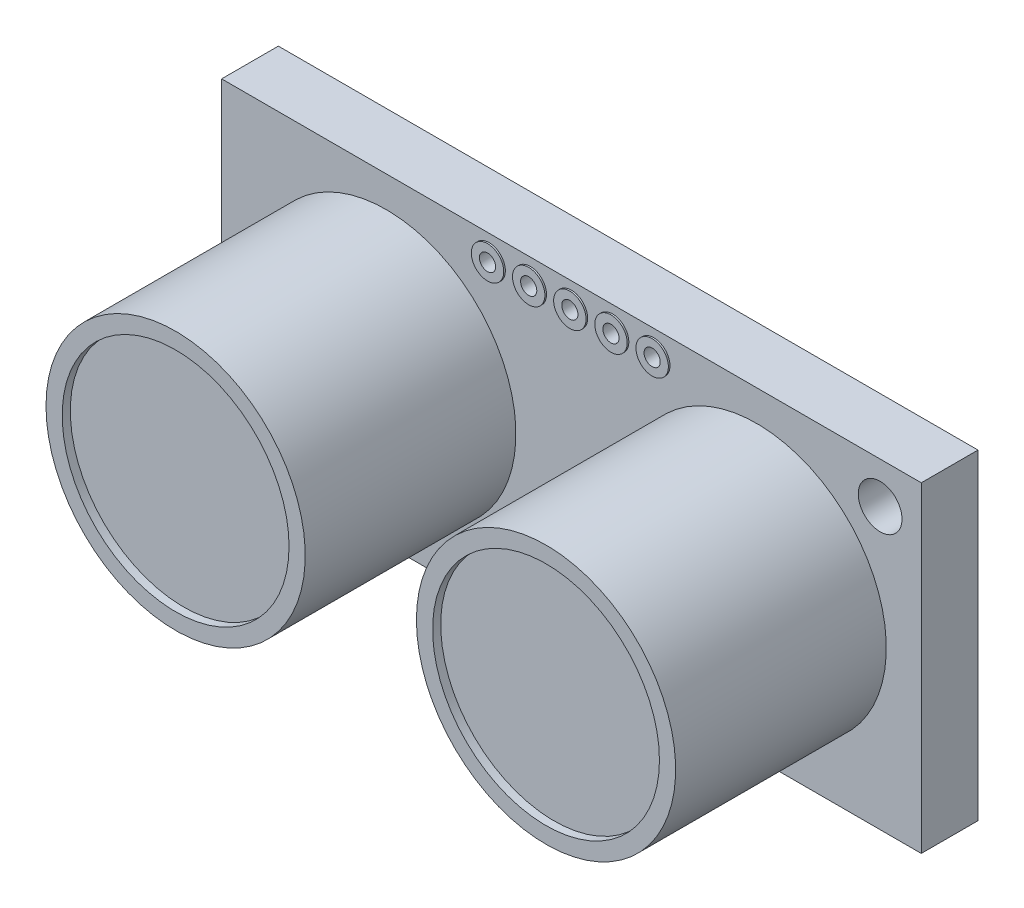
from build123d import *

# Parameters (mm, degrees)
SKETCH1_W                = 43.18
SKETCH1_H                = 19.812
SKETCH1_R                = 1.35
BOSS_EXTRUDE1_DEPTH      = 3.5
SKETCH2_R                = 8
BOSS_EXTRUDE2_DEPTH      = 13
SKETCH3_R                = 7
CUT_EXTRUDE1_DEPTH       = 0.5
EXTRUDE_THIN4_DEPTH      = 0.1
EXTRUDE_THIN4_DEPTH_BACK = 3.6
SKETCH4_R                = 1
SKETCH4_R_2              = 0.5
SKETCH11_R               = 0.5
CUT_EXTRUDE2_DEPTH       = 28.078717399
BOSS_EXTRUDE3_DEPTH      = 0.001


with BuildPart() as part:
    # Sketch1 → Boss-Extrude1 (new body)
    with BuildSketch(Plane.XY):
        Rectangle(SKETCH1_W, SKETCH1_H)
        with Locations((-19.05, -7.366)):
            Circle(SKETCH1_R, mode=Mode.SUBTRACT)
        with Locations((19.05, 7.366)):
            Circle(SKETCH1_R, mode=Mode.SUBTRACT)
    extrude(amount=BOSS_EXTRUDE1_DEPTH)

    # Sketch2 → Boss-Extrude2 (add)
    with BuildSketch(Plane.XY.offset(3.5)):
        with Locations((-11.43, 0)):
            Circle(SKETCH2_R)
        with Locations((11.43, 0)):
            Circle(SKETCH2_R)
    extrude(amount=BOSS_EXTRUDE2_DEPTH)

    # Sketch3 → Cut-Extrude1 (cut)
    with BuildSketch(Plane.XY.offset(16.5)):
        with Locations((-11.43, 0)):
            Circle(SKETCH3_R)
        with Locations((11.43, 0)):
            Circle(SKETCH3_R)
    extrude(amount=-CUT_EXTRUDE1_DEPTH, mode=Mode.SUBTRACT)

    # Sketch4 → Extrude-Thin4 (add, two sides: drawn at the far end of the back side and taken through both)
    # profile 1 of 10: a face of its own
    with BuildSketch(Plane.XY.offset(3.5).offset(-EXTRUDE_THIN4_DEPTH_BACK)):
        with Locations((0, 8.406)):
            Circle(SKETCH4_R)
        with Locations((0, 8.406)):
            Circle(SKETCH4_R_2, mode=Mode.SUBTRACT)
    # profile 2 of 10: a face of its own
    with BuildSketch(Plane.XY.offset(3.5).offset(-EXTRUDE_THIN4_DEPTH_BACK)):
        with Locations((2.54, 8.406)):
            Circle(SKETCH4_R)
        with Locations((2.54, 8.406)):
            Circle(SKETCH4_R_2, mode=Mode.SUBTRACT)
    # profile 3 of 10: a face of its own
    with BuildSketch(Plane.XY.offset(3.5).offset(-EXTRUDE_THIN4_DEPTH_BACK)):
        with Locations((5.08, 8.406)):
            Circle(SKETCH4_R)
        with Locations((5.08, 8.406)):
            Circle(SKETCH4_R_2, mode=Mode.SUBTRACT)
    # profile 4 of 10: a face of its own
    with BuildSketch(Plane.XY.offset(3.5).offset(-EXTRUDE_THIN4_DEPTH_BACK)):
        with Locations((-5.08, 8.406)):
            Circle(SKETCH4_R)
        with Locations((-5.08, 8.406)):
            Circle(SKETCH4_R_2, mode=Mode.SUBTRACT)
    # profile 5 of 10: a face of its own
    with BuildSketch(Plane.XY.offset(3.5).offset(-EXTRUDE_THIN4_DEPTH_BACK)):
        with Locations((-2.54, 8.406)):
            Circle(SKETCH4_R)
        with Locations((-2.54, 8.406)):
            Circle(SKETCH4_R_2, mode=Mode.SUBTRACT)
    # profile 6 of 10: a face of its own
    with BuildSketch(Plane.XY.offset(3.5).offset(-EXTRUDE_THIN4_DEPTH_BACK)):
        with Locations((-5.08, -8.406)):
            Circle(SKETCH4_R)
        with Locations((-5.08, -8.406)):
            Circle(SKETCH4_R_2, mode=Mode.SUBTRACT)
    # profile 7 of 10: a face of its own
    with BuildSketch(Plane.XY.offset(3.5).offset(-EXTRUDE_THIN4_DEPTH_BACK)):
        with Locations((-2.54, -8.406)):
            Circle(SKETCH4_R)
        with Locations((-2.54, -8.406)):
            Circle(SKETCH4_R_2, mode=Mode.SUBTRACT)
    # profile 8 of 10: a face of its own
    with BuildSketch(Plane.XY.offset(3.5).offset(-EXTRUDE_THIN4_DEPTH_BACK)):
        with Locations((0, -8.406)):
            Circle(SKETCH4_R)
        with Locations((0, -8.406)):
            Circle(SKETCH4_R_2, mode=Mode.SUBTRACT)
    # profile 9 of 10: a face of its own
    with BuildSketch(Plane.XY.offset(3.5).offset(-EXTRUDE_THIN4_DEPTH_BACK)):
        with Locations((2.54, -8.406)):
            Circle(SKETCH4_R)
        with Locations((2.54, -8.406)):
            Circle(SKETCH4_R_2, mode=Mode.SUBTRACT)
    # profile 10 of 10: a face of its own
    with BuildSketch(Plane.XY.offset(3.5).offset(-EXTRUDE_THIN4_DEPTH_BACK)):
        with Locations((5.08, -8.406)):
            Circle(SKETCH4_R)
        with Locations((5.08, -8.406)):
            Circle(SKETCH4_R_2, mode=Mode.SUBTRACT)
    extrude(amount=EXTRUDE_THIN4_DEPTH + EXTRUDE_THIN4_DEPTH_BACK)

    # Sketch11 → Cut-Extrude2 (cut, through all)
    with BuildSketch(Plane.XY.offset(3.5)):
        with Locations((-5.08, -8.406)):
            Circle(SKETCH11_R)
        with Locations((-2.54, -8.406)):
            Circle(SKETCH11_R)
        with Locations((0, -8.406)):
            Circle(SKETCH11_R)
        with Locations((2.54, -8.406)):
            Circle(SKETCH11_R)
        with Locations((5.08, -8.406)):
            Circle(SKETCH11_R)
        with Locations((-5.08, 8.406)):
            Circle(SKETCH11_R)
        with Locations((-2.54, 8.406)):
            Circle(SKETCH11_R)
        with Locations((0, 8.406)):
            Circle(SKETCH11_R)
        with Locations((2.54, 8.406)):
            Circle(SKETCH11_R)
        with Locations((5.08, 8.406)):
            Circle(SKETCH11_R)
    extrude(amount=-CUT_EXTRUDE2_DEPTH, mode=Mode.SUBTRACT)

    # Sketch12 → Boss-Extrude3 (add)
    # profile 1 of 5: a face of its own
    with BuildSketch(Plane(origin=(0, 0, 0), x_dir=(-1, 0, 0), z_dir=(0, 0, -1))):
        with BuildLine():
            add(Edge.make_bspline(
                [(19.46929145, -2.683893026), (19.484417806, -2.684223579), (19.51433311, -2.684877312), (19.55857677, -2.689412347), (19.601609877, -2.696623598), (19.643529262, -2.706555749), (19.684115837, -2.719918963), (19.723610749, -2.736127809), (19.762201128, -2.75474264), (19.799136653, -2.77713075), (19.834715807, -2.80169308), (19.86828259, -2.829333068), (19.900019773, -2.859416979), (19.929842776, -2.892296508), (19.95696226, -2.928352739), (19.982882923, -2.966466663), (20.006501357, -3.007561369), (20.028166536, -3.051214815), (20.047339104, -3.097375117), (20.064173328, -3.145621658), (20.078768602, -3.195935133), (20.090261272, -3.24837133), (20.099075501, -3.302915202), (20.10540034, -3.359565322), (20.109601073, -3.418341945), (20.109976956, -3.458260498), (20.110167222, -3.478466619)],
                knots=[0, 0, 0, 0, 0.949010564, 1.876852617, 2.787529374, 3.685273709, 4.577074086, 5.465471387, 6.362587764, 7.262213343, 8.172580635, 9.073145362, 9.987411958, 10.914456489, 11.85451744, 12.815917507, 13.804911429, 14.825868585, 15.871774033, 16.938849417, 18.030625794, 19.156736427, 20.304747212, 21.4957645, 22.732396811, 24, 24, 24, 24], degree=3))
            add(Edge.make_bspline(
                [(20.110167222, -3.478466619), (20.109713592, -3.502551257), (20.108822914, -3.54984022), (20.103860332, -3.619166231), (20.094377913, -3.685161229), (20.082197449, -3.748129578), (20.065811319, -3.807833441), (20.045507132, -3.864154145), (20.022642346, -3.91766615), (20.003613894, -3.950828686), (19.994191581, -3.967249769)],
                knots=[0, 0, 0, 0, 1.136969792, 2.232382444, 3.278022597, 4.282276305, 5.258039159, 6.196692155, 7.1070566, 8, 8, 8, 8], degree=3))
            add(Edge.make_bspline(
                [(19.994191581, -3.967249769), (19.980125855, -3.988503916), (19.952188373, -4.030719109), (19.900998849, -4.087338382), (19.843562074, -4.138033515), (19.780391, -4.18158225), (19.714579966, -4.217072851), (19.648412339, -4.243220973), (19.582822371, -4.259318087), (19.539200268, -4.261525811), (19.517848725, -4.262606417)],
                knots=[0, 0, 0, 0, 1.048346287, 2.082235551, 3.132143771, 4.197203545, 5.234784445, 6.204564675, 7.121195205, 8, 8, 8, 8], degree=3))
            add(Edge.make_bspline(
                [(19.517848725, -4.262606417), (19.505880841, -4.261996217), (19.482506815, -4.260804457), (19.448934686, -4.251239838), (19.418256579, -4.235582628), (19.390595856, -4.214519543), (19.367774744, -4.188124339), (19.351003002, -4.157808329), (19.340409896, -4.124045436), (19.339393406, -4.100293963), (19.338869017, -4.088041007)],
                knots=[0, 0, 0, 0, 1.029346977, 2.010378973, 2.978887221, 3.98112847, 4.985683985, 5.960201932, 6.947705008, 8, 8, 8, 8], degree=3))
            add(Edge.make_bspline(
                [(19.338869017, -4.088041007), (19.339245694, -4.078080516), (19.339975706, -4.058776797), (19.348168728, -4.031204492), (19.36058334, -4.005800586), (19.37898544, -3.982970809), (19.401999508, -3.962194269), (19.429956992, -3.943235584), (19.462379414, -3.925486113), (19.486424996, -3.91601565), (19.498987635, -3.911067797)],
                knots=[0, 0, 0, 0, 0.932019786, 1.806281372, 2.676477655, 3.570524242, 4.53911087, 5.576821434, 6.734007876, 8, 8, 8, 8], degree=3))
            add(Edge.make_bspline(
                [(19.498987635, -3.911067797), (19.514154901, -3.904497014), (19.543429775, -3.891814514), (19.585067298, -3.871507385), (19.622251922, -3.849696316), (19.656489949, -3.82744116), (19.687800087, -3.802502501), (19.714997365, -3.772135305), (19.740183391, -3.737971347), (19.761936387, -3.698509866), (19.780332925, -3.653726361), (19.792758911, -3.602341133), (19.800986198, -3.544947653), (19.801631627, -3.504449709), (19.80196898, -3.483282216)],
                knots=[0, 0, 0, 0, 1.049630502, 2.025928848, 2.939419198, 3.785195675, 4.618337008, 5.47201057, 6.365697361, 7.308725407, 8.32613671, 9.430404736, 10.656922266, 12, 12, 12, 12], degree=3))
            add(Edge.make_bspline(
                [(19.80196898, -3.483282216), (19.801786665, -3.468289639), (19.801429478, -3.438916536), (19.797209523, -3.39604058), (19.790984576, -3.355224522), (19.781715623, -3.316744761), (19.770034495, -3.280393465), (19.756022784, -3.246070232), (19.739234454, -3.213860117), (19.719531242, -3.184397308), (19.698330902, -3.157558433), (19.676051651, -3.13356403), (19.651734729, -3.113808265), (19.626201925, -3.097691901), (19.599724219, -3.084476637), (19.571616619, -3.075919648), (19.542461561, -3.069773451), (19.522430697, -3.06935428), (19.512230528, -3.069140828)],
                knots=[0, 0, 0, 0, 1.280312405, 2.508357684, 3.676903495, 4.804965861, 5.885491899, 6.935930188, 7.96843881, 8.982636488, 9.958848435, 10.888398438, 11.773624114, 12.626391924, 13.464564268, 14.292153698, 15.130326042, 16, 16, 16, 16], degree=3))
            add(Edge.make_bspline(
                [(19.512230528, -3.069140828), (19.496494601, -3.069862799), (19.466161185, -3.071254509), (19.423077099, -3.083358943), (19.384333744, -3.102661617), (19.351407073, -3.130916015), (19.322475421, -3.164394049), (19.297717898, -3.203046341), (19.27585837, -3.245712555), (19.257854232, -3.293840184), (19.241563213, -3.348197534), (19.224705921, -3.410023046), (19.207664422, -3.480218562), (19.196344494, -3.529818585), (19.190388093, -3.555917479)],
                knots=[0, 0, 0, 0, 0.888922646, 1.713534847, 2.512522705, 3.3189352, 4.1507089, 5.009465297, 5.910012526, 6.858957344, 7.912524916, 9.120887575, 10.485048098, 12, 12, 12, 12], degree=3))
            add(Edge.make_bspline(
                [(19.190388093, -3.555917479), (19.181929691, -3.590087259), (19.165660619, -3.655810153), (19.138396278, -3.749704133), (19.107487465, -3.834351038), (19.075996763, -3.911613713), (19.039365433, -3.980627007), (18.996986053, -4.042080143), (18.948115752, -4.095761163), (18.902393794, -4.13442943), (18.86273622, -4.160699668), (18.831410889, -4.178047101), (18.798259358, -4.192636269), (18.763245036, -4.204110897), (18.726634467, -4.213350814), (18.688309172, -4.220246185), (18.648186982, -4.224299229), (18.620819207, -4.224686994), (18.606898192, -4.224884237)],
                knots=[0, 0, 0, 0, 1.736572963, 3.340162069, 4.820136415, 6.180570834, 7.453029487, 8.666721429, 9.853271306, 11.024342417, 11.610026699, 12.197789198, 12.78876586, 13.39394109, 14.013340947, 14.650211638, 15.313410593, 16, 16, 16, 16], degree=3))
            add(Edge.make_bspline(
                [(18.606898192, -4.224884237), (18.593504819, -4.224740931), (18.567042485, -4.224457791), (18.527951434, -4.219539845), (18.489840843, -4.213216925), (18.453112282, -4.202724962), (18.417329584, -4.190475928), (18.382581113, -4.175232627), (18.349418394, -4.156536443), (18.317126027, -4.135826985), (18.286692517, -4.111986582), (18.25762662, -4.08581059), (18.230312173, -4.057111963), (18.205669793, -4.025320842), (18.181514952, -3.992245277), (18.160416695, -3.955702998), (18.14091815, -3.91689848), (18.11625726, -3.861474515), (18.091695675, -3.786346212), (18.070365196, -3.689863343), (18.058072069, -3.585795903), (18.056383732, -3.513947159), (18.055512274, -3.47686142)],
                knots=[0, 0, 0, 0, 0.769461614, 1.520285473, 2.262551752, 2.988378485, 3.713226575, 4.436358852, 5.166208618, 5.900059362, 6.640050888, 7.38609301, 8.147789305, 8.914131076, 9.697346069, 10.500657756, 11.336485078, 12.193936862, 13.986438256, 15.869279717, 17.867870641, 20, 20, 20, 20], degree=3))
            add(Edge.make_bspline(
                [(18.055512274, -3.47686142), (18.05600825, -3.447276945), (18.056966469, -3.390120075), (18.065519679, -3.307472284), (18.079250927, -3.231021329), (18.098946205, -3.160799164), (18.123752788, -3.096740742), (18.151543955, -3.038011171), (18.183353447, -2.98499297), (18.218799743, -2.938098441), (18.256208591, -2.896738524), (18.29544728, -2.86187447), (18.334774717, -2.831879), (18.375544801, -2.808851006), (18.416194468, -2.790441669), (18.45663055, -2.777736893), (18.496605537, -2.769471846), (18.523121397, -2.768598858), (18.536269428, -2.768165983)],
                knots=[0, 0, 0, 0, 1.50180492, 2.901470176, 4.213680385, 5.441471803, 6.598163128, 7.697894763, 8.73692932, 9.731292389, 10.678417777, 11.563424905, 12.393422888, 13.184490135, 13.9355001, 14.655109254, 15.333128709, 16, 16, 16, 16], degree=3))
            add(Edge.make_bspline(
                [(18.536269428, -2.768165983), (18.547968876, -2.768793298), (18.571072832, -2.770032115), (18.604767094, -2.779696382), (18.636323295, -2.79565456), (18.665371842, -2.817096846), (18.690072435, -2.843185233), (18.708902898, -2.872979724), (18.719626181, -2.906578955), (18.72097737, -2.929949853), (18.721669933, -2.941928794)],
                knots=[0, 0, 0, 0, 0.996524447, 1.967926831, 2.962621832, 3.998325838, 5.031199617, 6.009342139, 6.979672482, 8, 8, 8, 8], degree=3))
            add(Edge.make_bspline(
                [(18.721669933, -2.941928794), (18.721237923, -2.952509599), (18.720422718, -2.97247568), (18.71565128, -3.000753797), (18.705808035, -3.024736317), (18.692326163, -3.045597334), (18.674096087, -3.06379414), (18.652013526, -3.082466258), (18.625325748, -3.101924205), (18.605379739, -3.114352949), (18.594859198, -3.120908502)],
                knots=[0, 0, 0, 0, 1.091037725, 2.058798536, 2.936702634, 3.743333543, 4.601209271, 5.578930148, 6.723004324, 8, 8, 8, 8], degree=3))
            add(Edge.make_bspline(
                [(18.594859198, -3.120908502), (18.575539247, -3.130312653), (18.538259559, -3.14845886), (18.487226134, -3.180663145), (18.443363111, -3.216252044), (18.411121732, -3.248091479), (18.388932809, -3.276172478), (18.375392396, -3.300675856), (18.36395225, -3.327916675), (18.354092471, -3.357915788), (18.347112663, -3.391039717), (18.341977684, -3.42710389), (18.338748427, -3.466102827), (18.338272979, -3.493040834), (18.338027329, -3.506958904)],
                knots=[0, 0, 0, 0, 1.547925219, 2.986869477, 4.337480217, 5.612327564, 6.244828973, 6.909713596, 7.622436063, 8.372459485, 9.181850378, 10.058552105, 10.996911345, 12, 12, 12, 12], degree=3))
            add(Edge.make_bspline(
                [(18.338027329, -3.506958904), (18.338865045, -3.532558407), (18.340463722, -3.581411873), (18.352743768, -3.651016511), (18.374037305, -3.712842943), (18.398984211, -3.758442548), (18.422788372, -3.789499691), (18.44081972, -3.810017039), (18.460169787, -3.826920103), (18.480431517, -3.840723538), (18.501450251, -3.851609225), (18.523287707, -3.860004514), (18.546272099, -3.86424575), (18.561805072, -3.864961487), (18.569577311, -3.865319621)],
                knots=[0, 0, 0, 0, 1.953936482, 3.728844638, 5.372901677, 6.927342473, 7.670868145, 8.357884895, 9.009286022, 9.626820382, 10.225224998, 10.813344112, 11.406232554, 12, 12, 12, 12], degree=3))
            add(Edge.make_bspline(
                [(18.569577311, -3.865319621), (18.579113211, -3.864980933), (18.597877953, -3.864314463), (18.624868169, -3.857681525), (18.649829947, -3.847135242), (18.67264924, -3.832338988), (18.693462973, -3.81368373), (18.712613766, -3.79174254), (18.73098022, -3.767342768), (18.751816257, -3.730051612), (18.774805884, -3.681539116), (18.791979424, -3.629173216), (18.805454941, -3.582429304), (18.816688397, -3.537433055), (18.831039039, -3.483002716), (18.840542262, -3.443308216), (18.845671569, -3.421883348)],
                knots=[0, 0, 0, 0, 0.710597064, 1.398312741, 2.060329599, 2.724976052, 3.418105476, 4.139422309, 4.896209246, 5.692466705, 7.322744487, 8.895039973, 9.798770174, 10.953818098, 12.355841563, 14, 14, 14, 14], degree=3))
            add(Edge.make_bspline(
                [(18.845671569, -3.421883348), (18.852243438, -3.39456596), (18.865099634, -3.341126413), (18.885959774, -3.263074468), (18.907992459, -3.189099277), (18.93074843, -3.118931762), (18.955043623, -3.053188778), (18.983131163, -2.992870483), (19.012545732, -2.937168657), (19.045060109, -2.886506913), (19.081514481, -2.841201333), (19.121641686, -2.800461623), (19.167070347, -2.766064391), (19.216582316, -2.736142614), (19.271527657, -2.71228591), (19.332434707, -2.695591819), (19.3989918, -2.685475813), (19.445309679, -2.684432972), (19.46929145, -2.683893026)],
                knots=[0, 0, 0, 0, 1.267425996, 2.479397737, 3.644026965, 4.748891262, 5.806868875, 6.803181051, 7.748078724, 8.646880768, 9.513885508, 10.367259778, 11.219353025, 12.077259478, 12.971817986, 13.911770136, 14.918787934, 16, 16, 16, 16], degree=3))
        make_face()
    # profile 2 of 5: a face of its own
    with BuildSketch(Plane(origin=(0, 0, 0), x_dir=(-1, 0, 0), z_dir=(0, 0, -1))):
        with BuildLine():
            Line((19.236938869, -1.800230878), (19.236938869, -1.939080607))
            Line((19.236938869, -1.939080607), (19.867782146, -1.939080607))
            add(Edge.make_bspline(
                [(19.867782146, -1.939080607), (19.887227731, -1.939569463), (19.923611489, -1.940484139), (19.974280577, -1.950401281), (20.017014821, -1.967090735), (20.051586482, -1.990674356), (20.077777649, -2.01990028), (20.096740238, -2.053243428), (20.108349006, -2.090822708), (20.10955054, -2.117308302), (20.110167222, -2.130901909)],
                knots=[0, 0, 0, 0, 1.331902197, 2.492062242, 3.520752585, 4.456973203, 5.333663409, 6.188000262, 7.069999586, 8, 8, 8, 8], degree=3))
            add(Edge.make_bspline(
                [(20.110167222, -2.130901909), (20.109373291, -2.145409776), (20.107847372, -2.173293636), (20.09683532, -2.212967924), (20.076205729, -2.24664497), (20.048918398, -2.275511003), (20.013410064, -2.297766017), (19.970726045, -2.313122177), (19.921183627, -2.322818647), (19.88575683, -2.3238054), (19.866979546, -2.32432841)],
                knots=[0, 0, 0, 0, 0.98758274, 1.898116353, 2.767902367, 3.650180778, 4.579683533, 5.591031871, 6.723173417, 8, 8, 8, 8], degree=3))
            Line((19.866979546, -2.32432841), (18.351270222, -2.32432841))
            add(Edge.make_bspline(
                [(18.351270222, -2.32432841), (18.331280944, -2.323740288), (18.293773724, -2.322636755), (18.24188352, -2.311937018), (18.198309786, -2.294538775), (18.163257167, -2.268807182), (18.137095477, -2.234173002), (18.11923, -2.191152639), (18.108558909, -2.139709432), (18.107464294, -2.102600256), (18.106878648, -2.082745934)],
                knots=[0, 0, 0, 0, 1.204539147, 2.260157444, 3.178834964, 4.014831347, 4.849268471, 5.763683293, 6.803515522, 8, 8, 8, 8], degree=3))
            Line((18.106878648, -2.082745934), (18.106878648, -1.442271461))
            add(Edge.make_bspline(
                [(18.106878648, -1.442271461), (18.107059476, -1.42100132), (18.107407569, -1.380056515), (18.109303723, -1.320900151), (18.112849589, -1.266553391), (18.117921188, -1.216426566), (18.125407338, -1.169982505), (18.136034656, -1.126315058), (18.148886368, -1.084761869), (18.160527911, -1.058662721), (18.166271017, -1.045787265)],
                knots=[0, 0, 0, 0, 1.263018195, 2.431297115, 3.513891869, 4.496307935, 5.422122339, 6.30446181, 7.163542459, 8, 8, 8, 8], degree=3))
            add(Edge.make_bspline(
                [(18.166271017, -1.045787265), (18.173186513, -1.030381203), (18.186937288, -0.999747782), (18.213068639, -0.956540312), (18.243033035, -0.915964655), (18.27740064, -0.878682035), (18.314738259, -0.844403579), (18.35614933, -0.815189152), (18.399953527, -0.789676869), (18.44667819, -0.768825651), (18.495523638, -0.752581195), (18.54592107, -0.740211327), (18.597885926, -0.73347835), (18.632965113, -0.732475909), (18.650639869, -0.731970825)],
                knots=[0, 0, 0, 0, 0.991101386, 1.970706541, 2.959125982, 3.949043219, 4.94477413, 5.930285116, 6.919453739, 7.918248778, 8.929482208, 9.939493973, 10.961807665, 12, 12, 12, 12], degree=3))
            add(Edge.make_bspline(
                [(18.650639869, -0.731970825), (18.668583461, -0.73232809), (18.703639593, -0.733026073), (18.754754471, -0.73928432), (18.803248931, -0.748815301), (18.849139587, -0.762180424), (18.891914834, -0.780678697), (18.932132977, -0.802137642), (18.96957958, -0.827786237), (19.004173954, -0.857528021), (19.035791681, -0.89170093), (19.065916222, -0.928992469), (19.092585043, -0.97108369), (19.11714069, -1.016954235), (19.139142453, -1.067082964), (19.159163306, -1.121022773), (19.176521958, -1.179220962), (19.185676642, -1.219624181), (19.190388093, -1.240417665)],
                knots=[0, 0, 0, 0, 1.05507517, 2.061284822, 3.02416977, 3.960190338, 4.866266322, 5.760478336, 6.637811303, 7.530498893, 8.437803919, 9.372931164, 10.346335214, 11.363650695, 12.430976955, 13.56370004, 14.746160234, 16, 16, 16, 16], degree=3))
            add(Edge.make_bspline(
                [(19.190388093, -1.240417665), (19.200427827, -1.222376106), (19.220899361, -1.185588436), (19.259959389, -1.133796289), (19.304747277, -1.08278582), (19.356254388, -1.033986697), (19.411591028, -0.986799902), (19.469225772, -0.941636778), (19.528332151, -0.898760059), (19.588907267, -0.859624919), (19.648670628, -0.823618677), (19.706099342, -0.791258715), (19.760703138, -0.763640398), (19.811402894, -0.740153767), (19.856655487, -0.721449354), (19.894955835, -0.708122709), (19.925318671, -0.699169475), (19.94332506, -0.697397202), (19.950851203, -0.696656443)],
                knots=[0, 0, 0, 0, 1.035092047, 2.110606056, 3.247378518, 4.439119437, 5.667527541, 6.896357491, 8.113024158, 9.330801598, 10.514364801, 11.614385948, 12.638182879, 13.584379214, 14.418398752, 15.093545921, 15.621128711, 16, 16, 16, 16], degree=3))
            add(Edge.make_bspline(
                [(19.950851203, -0.696656443), (19.964041869, -0.697988111), (19.991453629, -0.700755473), (20.022873295, -0.717654824), (20.046183068, -0.73517527), (20.062660295, -0.75101425), (20.076500599, -0.769624107), (20.088663848, -0.79012526), (20.098335005, -0.812632242), (20.105021051, -0.837084422), (20.109741287, -0.863148392), (20.110023058, -0.881232034), (20.110167222, -0.890484244)],
                knots=[0, 0, 0, 0, 1.421053962, 2.95311776, 3.768369014, 4.575895034, 5.411397774, 6.266672613, 7.147343469, 8.048766422, 9.001682164, 10, 10, 10, 10], degree=3))
            add(Edge.make_bspline(
                [(20.110167222, -0.890484244), (20.109832205, -0.901356962), (20.109185491, -0.922345541), (20.10279153, -0.952381058), (20.093565654, -0.980199809), (20.074127778, -1.012575278), (20.044129385, -1.049196215), (20.006138096, -1.079661725), (19.970415066, -1.103157313), (19.937742869, -1.124120877), (19.899373952, -1.148105272), (19.871683967, -1.164876217), (19.856947051, -1.173801899)],
                knots=[0, 0, 0, 0, 0.812054064, 1.56758039, 2.289145878, 2.992867892, 4.379130512, 5.807652158, 6.615255223, 7.578411575, 8.711203985, 10, 10, 10, 10], degree=3))
            Line((19.856947051, -1.173801899), (19.591687887, -1.335124416))
            add(Edge.make_bspline(
                [(19.591687887, -1.335124416), (19.568712309, -1.348871396), (19.525264039, -1.374867804), (19.465196917, -1.414237897), (19.413821081, -1.45135698), (19.370496318, -1.486425891), (19.334807335, -1.520807514), (19.305094614, -1.55469524), (19.282105713, -1.589560527), (19.264098857, -1.62500043), (19.25142667, -1.663012017), (19.243523551, -1.704868082), (19.237482435, -1.750965884), (19.237125087, -1.783353374), (19.236938869, -1.800230878)],
                knots=[0, 0, 0, 0, 1.549240544, 2.929711722, 4.154429701, 5.215920692, 6.152032193, 7.019334908, 7.817977517, 8.562251951, 9.313736963, 10.127430344, 11.024181782, 12, 12, 12, 12], degree=3))
        make_face()
        with BuildLine():
            Line((18.41507689, -1.573095194), (18.41507689, -1.939080607))
            Line((18.41507689, -1.939080607), (18.954423814, -1.939080607))
            Line((18.954423814, -1.939080607), (18.954423814, -1.583930289))
            add(Edge.make_bspline(
                [(18.954423814, -1.583930289), (18.954079771, -1.561052235), (18.95341716, -1.516990022), (18.949415073, -1.453810733), (18.941134359, -1.396364754), (18.930772368, -1.34454499), (18.916521718, -1.298160403), (18.897635038, -1.257536318), (18.874321584, -1.222486007), (18.846171277, -1.193339399), (18.812927068, -1.170191533), (18.773918643, -1.154204272), (18.729500531, -1.144486988), (18.698046819, -1.143447393), (18.681539953, -1.142901815)],
                knots=[0, 0, 0, 0, 1.392674693, 2.682235545, 3.849820756, 4.922907172, 5.896284646, 6.795937237, 7.640517491, 8.44662346, 9.24840026, 10.087665541, 10.996409465, 12, 12, 12, 12], degree=3))
            add(Edge.make_bspline(
                [(18.681539953, -1.142901815), (18.668249815, -1.143268512), (18.642212955, -1.143986913), (18.604681271, -1.152433954), (18.569452481, -1.16532031), (18.537115649, -1.183502086), (18.507412206, -1.205750853), (18.482699331, -1.233431705), (18.460183411, -1.263853075), (18.44971231, -1.287133705), (18.444371775, -1.299007435)],
                knots=[0, 0, 0, 0, 1.054707271, 2.066288818, 3.042079463, 4.027441999, 5.005836686, 5.976573042, 6.967999406, 8, 8, 8, 8], degree=3))
            add(Edge.make_bspline(
                [(18.444371775, -1.299007435), (18.441988909, -1.305526806), (18.436809149, -1.319698305), (18.430881077, -1.343610178), (18.426457055, -1.371717154), (18.421820998, -1.403777985), (18.418718916, -1.440083634), (18.417027438, -1.480653587), (18.415124285, -1.525457961), (18.415093129, -1.556773176), (18.41507689, -1.573095194)],
                knots=[0, 0, 0, 0, 0.601274756, 1.307022564, 2.130372336, 3.066540635, 4.11402688, 5.286356465, 6.585603249, 8, 8, 8, 8], degree=3))
        make_face(mode=Mode.SUBTRACT)
    # profile 3 of 5: a face of its own
    with BuildSketch(Plane(origin=(0, 0, 0), x_dir=(-1, 0, 0), z_dir=(0, 0, -1))):
        with BuildLine():
            Line((18.41507689, 0.831091874), (18.41507689, 0.03852478))
            Line((18.41507689, 0.03852478), (18.90305744, 0.03852478))
            Line((18.90305744, 0.03852478), (18.90305744, 0.701070741))
            add(Edge.make_bspline(
                [(18.90305744, 0.701070741), (18.903613439, 0.715413667), (18.904661621, 0.742453239), (18.911903609, 0.780369065), (18.925277155, 0.812518682), (18.943900572, 0.838849766), (18.967510759, 0.858807873), (18.994304088, 0.873595087), (19.02506835, 0.882258308), (19.04666647, 0.883180155), (19.057959161, 0.883662148)],
                knots=[0, 0, 0, 0, 1.26669481, 2.387998457, 3.388485007, 4.319542635, 5.207485584, 6.095585677, 7.004267047, 8, 8, 8, 8], degree=3))
            add(Edge.make_bspline(
                [(19.057959161, 0.883662148), (19.069130511, 0.88321293), (19.090655946, 0.882347357), (19.121027017, 0.873143115), (19.147808526, 0.858472273), (19.170645521, 0.837865736), (19.189603068, 0.811861023), (19.202068778, 0.779509499), (19.210356549, 0.742155267), (19.210944216, 0.715302712), (19.211255682, 0.701070741)],
                knots=[0, 0, 0, 0, 0.989664805, 1.906928296, 2.789763925, 3.681746705, 4.618201249, 5.619917427, 6.738545855, 8, 8, 8, 8], degree=3))
            Line((19.211255682, 0.701070741), (19.211255682, 0.03852478))
            Line((19.211255682, 0.03852478), (19.864973047, 0.03852478))
            add(Edge.make_bspline(
                [(19.864973047, 0.03852478), (19.884417787, 0.038018097), (19.921062558, 0.037063222), (19.972118122, 0.027229681), (20.0155337, 0.010593866), (20.050380879, -0.013618022), (20.077248594, -0.042893545), (20.096712963, -0.07623171), (20.108341425, -0.113614522), (20.109547944, -0.139837104), (20.110167222, -0.153296522)],
                knots=[0, 0, 0, 0, 1.324444831, 2.495995325, 3.52738831, 4.471056898, 5.361856607, 6.215950617, 7.08429057, 8, 8, 8, 8], degree=3))
            add(Edge.make_bspline(
                [(20.110167222, -0.153296522), (20.109605163, -0.167039311), (20.108513617, -0.193728494), (20.096189432, -0.231456844), (20.077015102, -0.265268078), (20.049944741, -0.29453884), (20.015324498, -0.318815862), (19.972223157, -0.334677303), (19.92222676, -0.345509719), (19.886177446, -0.346301411), (19.866979546, -0.346723022)],
                knots=[0, 0, 0, 0, 0.935929894, 1.817622685, 2.681511336, 3.574268386, 4.520010484, 5.54180128, 6.690897382, 8, 8, 8, 8], degree=3))
            Line((19.866979546, -0.346723022), (18.351270222, -0.346723022))
            add(Edge.make_bspline(
                [(18.351270222, -0.346723022), (18.337613974, -0.346409172), (18.31156212, -0.345810443), (18.274308319, -0.341478689), (18.240859588, -0.334033398), (18.211201187, -0.323269338), (18.185352027, -0.309076693), (18.163231499, -0.291310698), (18.145502574, -0.269437557), (18.130724475, -0.244671574), (18.120020842, -0.216084928), (18.112619549, -0.184100213), (18.107659661, -0.148632924), (18.107146592, -0.123752337), (18.106878648, -0.110758743)],
                knots=[0, 0, 0, 0, 1.24824502, 2.381261253, 3.422463234, 4.374230178, 5.255516348, 6.107294269, 6.949627804, 7.815767679, 8.733215993, 9.726798055, 10.812847089, 12, 12, 12, 12], degree=3))
            Line((18.106878648, -0.110758743), (18.106878648, 0.831091874))
            add(Edge.make_bspline(
                [(18.106878648, 0.831091874), (18.107419374, 0.846105218), (18.108431651, 0.874211211), (18.115756938, 0.913549918), (18.128983591, 0.94682447), (18.147704949, 0.974014748), (18.171111535, 0.994724783), (18.197774958, 1.01008444), (18.228041573, 1.019081164), (18.2492808, 1.020022521), (18.260175169, 1.020505377)],
                knots=[0, 0, 0, 0, 1.305293606, 2.443597845, 3.460957068, 4.396713591, 5.286368424, 6.156339552, 7.054319707, 8, 8, 8, 8], degree=3))
            add(Edge.make_bspline(
                [(18.260175169, 1.020505377), (18.271334872, 1.020028052), (18.292966356, 1.019102824), (18.323677153, 1.010177935), (18.350433405, 0.994714209), (18.373878091, 0.974028619), (18.392484118, 0.946733302), (18.406327536, 0.913658099), (18.413481542, 0.874193565), (18.414521419, 0.846099074), (18.41507689, 0.831091874)],
                knots=[0, 0, 0, 0, 0.964185515, 1.868935361, 2.734709653, 3.620072693, 4.551315024, 5.56819034, 6.701003273, 8, 8, 8, 8], degree=3))
        make_face()
    # profile 4 of 5: a face of its own
    with BuildSketch(Plane(origin=(0, 0, 0), x_dir=(-1, 0, 0), z_dir=(0, 0, -1))):
        with BuildLine():
            add(Edge.make_bspline(
                [(19.106516436, 2.632526652), (19.141835751, 2.632229246), (19.209967989, 2.631655539), (19.308249757, 2.626997012), (19.398761863, 2.618602882), (19.482253002, 2.607057531), (19.560542405, 2.591720398), (19.634128598, 2.569881976), (19.704417817, 2.543184103), (19.748384706, 2.520578198), (19.770266296, 2.509327615)],
                knots=[0, 0, 0, 0, 1.24224353, 2.396332709, 3.459542317, 4.438314338, 5.360108057, 6.262326286, 7.135188689, 8, 8, 8, 8], degree=3))
            add(Edge.make_bspline(
                [(19.770266296, 2.509327615), (19.796238869, 2.493356301), (19.84731425, 2.461948518), (19.915518903, 2.4049938), (19.973914595, 2.340776938), (20.014915562, 2.282067001), (20.042671038, 2.232414747), (20.060896355, 2.194117806), (20.076073961, 2.154782925), (20.088693451, 2.114329505), (20.098197263, 2.072848493), (20.104920753, 2.030337976), (20.109716099, 1.986944655), (20.110015719, 1.957553808), (20.110167222, 1.942692305)],
                knots=[0, 0, 0, 0, 1.580397239, 3.107870444, 4.591483573, 6.071993126, 6.811458575, 7.540989501, 8.270454403, 8.997041459, 9.737775931, 10.475970176, 11.229373204, 12, 12, 12, 12], degree=3))
            add(Edge.make_bspline(
                [(20.110167222, 1.942692305), (20.109718196, 1.925559498), (20.108832126, 1.891751038), (20.103695385, 1.841654894), (20.094349905, 1.79312107), (20.081613702, 1.745786103), (20.06442702, 1.700104779), (20.044636251, 1.655282106), (20.020197098, 1.612285153), (19.992671858, 1.570639979), (19.961742497, 1.530994432), (19.928087771, 1.493560555), (19.89131671, 1.458963723), (19.851884325, 1.426791904), (19.809563419, 1.396930283), (19.764310686, 1.369821714), (19.716326927, 1.345111161), (19.682882324, 1.331027441), (19.665928349, 1.323888022)],
                knots=[0, 0, 0, 0, 1.013654932, 2.000262503, 2.974897205, 3.934739091, 4.89611284, 5.859471119, 6.830211065, 7.817833599, 8.810294581, 9.80196658, 10.792754173, 11.793821649, 12.810314228, 13.853919655, 14.912093751, 16, 16, 16, 16], degree=3))
            add(Edge.make_bspline(
                [(19.665928349, 1.323888022), (19.647007278, 1.317362039), (19.608570638, 1.304105029), (19.548417049, 1.288361527), (19.485529948, 1.274586148), (19.419582491, 1.263994583), (19.350935851, 1.255380462), (19.279537018, 1.250156534), (19.205413136, 1.246244083), (19.155079376, 1.245840526), (19.129390524, 1.245634562)],
                knots=[0, 0, 0, 0, 0.881300005, 1.790290336, 2.736775026, 3.716068374, 4.731167005, 5.783179305, 6.86860072, 8, 8, 8, 8], degree=3))
            add(Edge.make_bspline(
                [(19.129390524, 1.245634562), (19.096478877, 1.24581142), (19.032368438, 1.246155933), (18.938700156, 1.250395995), (18.850071591, 1.256551884), (18.766655823, 1.265702143), (18.688568653, 1.277654723), (18.616097279, 1.292412755), (18.549010143, 1.309616833), (18.507144394, 1.324648709), (18.486909553, 1.331914018)],
                knots=[0, 0, 0, 0, 1.212279312, 2.361466649, 3.453316133, 4.484503641, 5.451820176, 6.362159784, 7.208387816, 8, 8, 8, 8], degree=3))
            add(Edge.make_bspline(
                [(18.486909553, 1.331914018), (18.470762432, 1.338797397), (18.439090545, 1.35229885), (18.393905476, 1.375770783), (18.351605985, 1.401428877), (18.312314366, 1.429638291), (18.275545254, 1.459621046), (18.242124048, 1.49238498), (18.211643121, 1.527246128), (18.184075597, 1.564314197), (18.160261953, 1.603782107), (18.138751625, 1.644597846), (18.120956434, 1.68760281), (18.106794002, 1.732538064), (18.094866717, 1.779084947), (18.08704658, 1.827573387), (18.082066536, 1.877843888), (18.081489197, 1.912047461), (18.081195461, 1.929449412)],
                knots=[0, 0, 0, 0, 1.091111206, 2.140167975, 3.162946158, 4.164640209, 5.145466981, 6.110078272, 7.070916974, 8.022458711, 8.978207941, 9.93428284, 10.888873235, 11.867369661, 12.861889973, 13.873753768, 14.918217287, 16, 16, 16, 16], degree=3))
            add(Edge.make_bspline(
                [(18.081195461, 1.929449412), (18.081723841, 1.95221394), (18.08275952, 1.99683471), (18.091218762, 2.062204185), (18.10583724, 2.124195221), (18.125387812, 2.183190919), (18.150790744, 2.238690583), (18.181388382, 2.290787594), (18.217460233, 2.339211537), (18.258478864, 2.38436989), (18.305210684, 2.425912391), (18.356731361, 2.464235634), (18.413602923, 2.49918336), (18.454096894, 2.51914973), (18.474870559, 2.529392605)],
                knots=[0, 0, 0, 0, 1.074291325, 2.105719259, 3.104291516, 4.076669601, 5.034507252, 5.979860306, 6.923186968, 7.879670961, 8.854444549, 9.869744472, 10.907165378, 12, 12, 12, 12], degree=3))
            add(Edge.make_bspline(
                [(18.474870559, 2.529392605), (18.494274321, 2.537752753), (18.534475983, 2.555073718), (18.599412009, 2.575284139), (18.669748181, 2.593668212), (18.745981047, 2.607674679), (18.827921243, 2.618995107), (18.915642296, 2.626780271), (19.009211874, 2.631677728), (19.073469623, 2.632238338), (19.106516436, 2.632526652)],
                knots=[0, 0, 0, 0, 0.786151885, 1.628787956, 2.528718292, 3.491837123, 4.512437559, 5.607691779, 6.769671193, 8, 8, 8, 8], degree=3))
        make_face()
        with BuildLine():
            add(Edge.make_bspline(
                [(19.079629349, 2.272962036), (19.059696796, 2.27292552), (19.020761012, 2.27285419), (18.963770403, 2.271119664), (18.909457568, 2.268706556), (18.857917259, 2.265723448), (18.809109524, 2.261095884), (18.763157111, 2.256178964), (18.719979547, 2.249536306), (18.667478266, 2.240450974), (18.607712381, 2.225851541), (18.543220143, 2.20308724), (18.48859093, 2.173999166), (18.449507112, 2.145591622), (18.424452393, 2.119130012), (18.407853958, 2.098402936), (18.393978671, 2.075662432), (18.383278075, 2.050817014), (18.374487988, 2.024516972), (18.367893165, 1.996476021), (18.364382389, 1.96659381), (18.363938817, 1.946045064), (18.363710516, 1.935468909)],
                knots=[0, 0, 0, 0, 1.347647352, 2.632462932, 3.854663529, 5.023633764, 6.122520203, 7.169251864, 8.147763337, 9.075642165, 10.771294062, 12.302045326, 13.685839966, 14.944833451, 15.546133651, 16.145048405, 16.737578031, 17.340915391, 17.970135936, 18.610758548, 19.284976654, 20, 20, 20, 20], degree=3))
            add(Edge.make_bspline(
                [(18.363710516, 1.935468909), (18.364192231, 1.920571457), (18.365124992, 1.891725042), (18.373978349, 1.85030237), (18.38730497, 1.811959373), (18.407436578, 1.777584114), (18.432609229, 1.746561269), (18.463620675, 1.719445005), (18.500299644, 1.696182912), (18.542466521, 1.675985409), (18.590624731, 1.659655884), (18.644281719, 1.644595282), (18.703994544, 1.632458566), (18.769778441, 1.622552916), (18.841391229, 1.614569266), (18.919168931, 1.609042924), (19.002821843, 1.605950238), (19.060631927, 1.60545483), (19.090464444, 1.605199178)],
                knots=[0, 0, 0, 0, 0.800712426, 1.5504452, 2.270089568, 2.976430944, 3.68255215, 4.411961279, 5.182793406, 6.01355921, 6.922072822, 7.915944648, 9.011614588, 10.198826553, 11.495524534, 12.888644882, 14.39440548, 16, 16, 16, 16], degree=3))
            add(Edge.make_bspline(
                [(19.090464444, 1.605199178), (19.110932047, 1.605235546), (19.150937738, 1.605306631), (19.20953304, 1.607046425), (19.265318486, 1.609439052), (19.318326037, 1.612464562), (19.368476214, 1.617041909), (19.415761158, 1.621990873), (19.460144471, 1.628626051), (19.514234474, 1.637735082), (19.575762032, 1.652193043), (19.64206719, 1.675095787), (19.69827873, 1.704165433), (19.738723218, 1.732537503), (19.764738151, 1.758881379), (19.782047496, 1.779363482), (19.795956602, 1.802112464), (19.807690286, 1.82611383), (19.81660243, 1.851871007), (19.822885677, 1.879181091), (19.827116195, 1.908183521), (19.827470833, 1.928096222), (19.827652166, 1.938278008)],
                knots=[0, 0, 0, 0, 1.360892793, 2.659982061, 3.897473583, 5.073706367, 6.189819789, 7.245725, 8.234419589, 9.173203856, 10.892611866, 12.431469099, 13.823825965, 15.090508813, 15.694289814, 16.281935201, 16.869311273, 17.462050397, 18.055589799, 18.676935243, 19.323488959, 20, 20, 20, 20], degree=3))
            add(Edge.make_bspline(
                [(19.827652166, 1.938278008), (19.827459482, 1.94885691), (19.827084799, 1.969428031), (19.823076503, 1.999320288), (19.815980489, 2.027298693), (19.807168508, 2.053975455), (19.794348351, 2.078281146), (19.779943836, 2.101385361), (19.762022261, 2.122077728), (19.734815917, 2.148329389), (19.693617662, 2.176787199), (19.636475088, 2.205337947), (19.570015243, 2.227952713), (19.508582913, 2.24168281), (19.454797363, 2.250393776), (19.410377564, 2.256473852), (19.362862263, 2.261558762), (19.312170783, 2.26607211), (19.258506704, 2.269258193), (19.201629692, 2.270974914), (19.141709106, 2.272893639), (19.100632508, 2.272938896), (19.079629349, 2.272962036)],
                knots=[0, 0, 0, 0, 0.693691847, 1.348913083, 1.972464501, 2.585744591, 3.186146807, 3.7702996, 4.368002788, 4.976177112, 6.247129624, 7.632347309, 9.155818429, 10.839487285, 11.755496797, 12.729633812, 13.780021632, 14.889824529, 16.067712469, 17.305706588, 18.622362222, 20, 20, 20, 20], degree=3))
        make_face(mode=Mode.SUBTRACT)
    # profile 5 of 5: a face of its own
    with BuildSketch(Plane(origin=(0, 0, 0), x_dir=(-1, 0, 0), z_dir=(0, 0, -1))):
        with BuildLine():
            Line((18.41507689, 4.052325325), (18.41507689, 3.408640455))
            Line((18.41507689, 3.408640455), (18.858111863, 3.331590894))
            add(Edge.make_bspline(
                [(18.858111863, 3.331590894), (18.849372161, 3.347416978), (18.83232872, 3.378279694), (18.810301299, 3.425128392), (18.791180191, 3.470806149), (18.776098168, 3.515810941), (18.763708031, 3.559663658), (18.755451, 3.602771566), (18.749823896, 3.64485691), (18.749243379, 3.672678346), (18.748958319, 3.686339912)],
                knots=[0, 0, 0, 0, 1.156031135, 2.254395925, 3.309385178, 4.321273619, 5.288520282, 6.221443175, 7.12664928, 8, 8, 8, 8], degree=3))
            add(Edge.make_bspline(
                [(18.748958319, 3.686339912), (18.749600508, 3.707640722), (18.750874786, 3.749907314), (18.760265351, 3.812058908), (18.775697892, 3.872119109), (18.796795396, 3.929746056), (18.82385133, 3.984318175), (18.855490592, 4.035561129), (18.892390055, 4.082624178), (18.933223116, 4.126200608), (18.979003778, 4.165238096), (19.028649006, 4.200166769), (19.082499766, 4.230364357), (19.139784898, 4.256072517), (19.200278086, 4.276420961), (19.263235659, 4.291389899), (19.32857065, 4.300458239), (19.372950592, 4.301437359), (19.395452288, 4.301933797)],
                knots=[0, 0, 0, 0, 1.026611596, 2.037076288, 3.022413444, 4.011898786, 4.989546235, 5.954025754, 6.909843404, 7.867790456, 8.828122028, 9.804918424, 10.789537881, 11.79981737, 12.827582723, 13.861459599, 14.915708723, 16, 16, 16, 16], degree=3))
            add(Edge.make_bspline(
                [(19.395452288, 4.301933797), (19.427760845, 4.301000554), (19.491452581, 4.299160798), (19.584540928, 4.282526958), (19.673344131, 4.256153624), (19.743115518, 4.224727502), (19.796031193, 4.195027439), (19.833505069, 4.169956984), (19.868923881, 4.142628055), (19.902292054, 4.11283599), (19.93379586, 4.080629702), (19.962913853, 4.045791009), (19.989948876, 4.008625047), (20.014790425, 3.969371525), (20.037215678, 3.928101777), (20.057080893, 3.885039332), (20.073469972, 3.840048223), (20.086652966, 3.793324917), (20.097070771, 3.745070865), (20.104800343, 3.695108082), (20.109155907, 3.643345), (20.109827056, 3.608228002), (20.110167222, 3.590429262)],
                knots=[0, 0, 0, 0, 1.711147685, 3.37328478, 4.994949039, 6.610339793, 7.416750561, 8.209202439, 8.997679871, 9.78606167, 10.578228054, 11.383422398, 12.190331681, 13.012514466, 13.843726651, 14.67810767, 15.523709018, 16.378768627, 17.249296324, 18.138703239, 19.056618197, 20, 20, 20, 20], degree=3))
            add(Edge.make_bspline(
                [(20.110167222, 3.590429262), (20.110029573, 3.570620959), (20.10976134, 3.532021183), (20.104957625, 3.475528244), (20.098416024, 3.421904449), (20.088923802, 3.371014887), (20.075862869, 3.323271736), (20.060882851, 3.278195185), (20.042627602, 3.236101435), (20.015367049, 3.184968357), (19.97737006, 3.127927944), (19.928051276, 3.068075475), (19.875002096, 3.019232253), (19.818791666, 2.982463432), (19.763375376, 2.955233192), (19.710956897, 2.935049363), (19.661819588, 2.922646891), (19.630004461, 2.92075278), (19.614963275, 2.919857305)],
                knots=[0, 0, 0, 0, 1.032093293, 2.011205585, 2.952964999, 3.847252965, 4.706415705, 5.531020485, 6.32109392, 7.094596524, 8.548774814, 9.885141963, 11.128927262, 12.291106832, 13.373074573, 14.341704631, 15.216010439, 16, 16, 16, 16], degree=3))
            add(Edge.make_bspline(
                [(19.614963275, 2.919857305), (19.606210548, 2.920433457), (19.588608352, 2.921592128), (19.562731976, 2.930058215), (19.537928092, 2.944245064), (19.514260253, 2.962997428), (19.494033772, 2.986363654), (19.47858252, 3.013046312), (19.469540552, 3.042885546), (19.468578208, 3.063730026), (19.468087551, 3.074357726)],
                knots=[0, 0, 0, 0, 0.891772366, 1.793401163, 2.746006762, 3.79412415, 4.857924086, 5.878153834, 6.918162393, 8, 8, 8, 8], degree=3))
            add(Edge.make_bspline(
                [(19.468087551, 3.074357726), (19.468458986, 3.08361867), (19.469183352, 3.101679177), (19.475268649, 3.127847084), (19.486010538, 3.15189885), (19.50068826, 3.174213056), (19.519323785, 3.194825984), (19.54212509, 3.213335038), (19.569003822, 3.229972694), (19.588895456, 3.238986017), (19.599312583, 3.243706239)],
                knots=[0, 0, 0, 0, 0.971980174, 1.895536086, 2.801396063, 3.724951974, 4.689900168, 5.708100931, 6.799746478, 8, 8, 8, 8], degree=3))
            add(Edge.make_bspline(
                [(19.599312583, 3.243706239), (19.618605276, 3.252947921), (19.656231428, 3.270971788), (19.706342123, 3.306101341), (19.750693166, 3.344688241), (19.787040057, 3.38871904), (19.816822057, 3.436007575), (19.837697662, 3.486927191), (19.851313901, 3.540358549), (19.85265739, 3.57710356), (19.853335353, 3.595646159)],
                knots=[0, 0, 0, 0, 1.114388395, 2.173369472, 3.181905356, 4.172949301, 5.141395086, 6.086316069, 7.034299513, 8, 8, 8, 8], degree=3))
            add(Edge.make_bspline(
                [(19.853335353, 3.595646159), (19.852823796, 3.61256197), (19.851822654, 3.64566697), (19.840895931, 3.693386761), (19.823949337, 3.737974842), (19.800131474, 3.778859097), (19.770506171, 3.815975639), (19.736015029, 3.849272129), (19.695423165, 3.876987169), (19.650592086, 3.900560261), (19.601617798, 3.919494935), (19.549026832, 3.93253509), (19.493361462, 3.940778383), (19.455142016, 3.941830655), (19.435582267, 3.942369181)],
                knots=[0, 0, 0, 0, 0.999542791, 1.956150026, 2.880941895, 3.813831331, 4.743625034, 5.684375802, 6.639737325, 7.641941603, 8.677003637, 9.738847702, 10.842799317, 12, 12, 12, 12], degree=3))
            add(Edge.make_bspline(
                [(19.435582267, 3.942369181), (19.414676468, 3.941924173), (19.374401046, 3.941066855), (19.316299573, 3.931840157), (19.262818184, 3.917800449), (19.214337515, 3.897570273), (19.171207667, 3.872680684), (19.133582011, 3.843744443), (19.101582822, 3.810769135), (19.075938787, 3.773769963), (19.056398044, 3.733667052), (19.041564366, 3.691616294), (19.033067487, 3.647086334), (19.032009752, 3.616682262), (19.031473374, 3.601264356)],
                knots=[0, 0, 0, 0, 1.264307668, 2.435712816, 3.551282472, 4.603813104, 5.605052054, 6.557298982, 7.467737889, 8.37511164, 9.269460386, 10.16050474, 11.067191922, 12, 12, 12, 12], degree=3))
            add(Edge.make_bspline(
                [(19.031473374, 3.601264356), (19.031628773, 3.583181318), (19.031916326, 3.549720191), (19.03772147, 3.503682886), (19.045706175, 3.465480839), (19.059271863, 3.43370358), (19.078135731, 3.404385076), (19.100499511, 3.371318288), (19.127967926, 3.332434303), (19.159541042, 3.290663784), (19.189767927, 3.247997146), (19.212540417, 3.207222667), (19.227341726, 3.170181789), (19.229520531, 3.146292656), (19.230518072, 3.135355295)],
                knots=[0, 0, 0, 0, 1.253320121, 2.319162568, 3.215033915, 3.951008832, 4.700606019, 5.629743289, 6.721449385, 8.002092677, 9.263357855, 10.343167053, 11.241438274, 12, 12, 12, 12], degree=3))
            add(Edge.make_bspline(
                [(19.230518072, 3.135355295), (19.229874574, 3.124456411), (19.228613145, 3.103091687), (19.219280336, 3.07193618), (19.203906581, 3.042885246), (19.18262433, 3.016799516), (19.158027101, 2.994698815), (19.130976942, 2.977985205), (19.101867706, 2.967830534), (19.081712863, 2.966615988), (19.071603354, 2.966006781)],
                knots=[0, 0, 0, 0, 1.021493999, 2.002401241, 3.024126496, 4.086435777, 5.144287797, 6.112833732, 7.053412325, 8, 8, 8, 8], degree=3))
            add(Edge.make_bspline(
                [(19.071603354, 2.966006781), (19.068790919, 2.966247304), (19.059906835, 2.967007082), (19.041630388, 2.970270162), (19.013415348, 2.974955147), (18.991209461, 2.97870752), (18.978501801, 2.980854874)],
                knots=[0, 0, 0, 0, 0.359093097, 1.134324626, 2.360073298, 4, 4, 4, 4], degree=3))
            Line((18.978501801, 2.980854874), (18.321975337, 3.094422716))
            add(Edge.make_bspline(
                [(18.321975337, 3.094422716), (18.304351772, 3.097885412), (18.271150508, 3.104408831), (18.225763768, 3.119886248), (18.188025222, 3.139696931), (18.156850682, 3.163659733), (18.133064708, 3.195027974), (18.118076223, 3.234349173), (18.108274262, 3.280947768), (18.107366378, 3.31467561), (18.106878648, 3.332794793)],
                knots=[0, 0, 0, 0, 1.194129083, 2.249635226, 3.177331393, 4.019641834, 4.845571199, 5.759547176, 6.796389752, 8, 8, 8, 8], degree=3))
            Line((18.106878648, 3.332794793), (18.106878648, 4.044299329))
            add(Edge.make_bspline(
                [(18.106878648, 4.044299329), (18.107284527, 4.060245639), (18.108046585, 4.090185616), (18.115071789, 4.132191378), (18.127314844, 4.167840112), (18.144393195, 4.19754394), (18.166860371, 4.220796847), (18.194920954, 4.23666268), (18.227408985, 4.246622876), (18.25073308, 4.247630409), (18.262984268, 4.248159625)],
                knots=[0, 0, 0, 0, 1.306773136, 2.453530613, 3.476791313, 4.381515022, 5.242365076, 6.092600397, 6.998121453, 8, 8, 8, 8], degree=3))
            add(Edge.make_bspline(
                [(18.262984268, 4.248159625), (18.27388415, 4.247548867), (18.295033553, 4.246363794), (18.325140412, 4.236965643), (18.351451876, 4.220704031), (18.37428354, 4.198622855), (18.392891039, 4.170511211), (18.406268197, 4.13624861), (18.413449514, 4.096095313), (18.41451386, 4.067468615), (18.41507689, 4.052325325)],
                knots=[0, 0, 0, 0, 0.934297721, 1.812848832, 2.673138209, 3.566118365, 4.518019535, 5.543292166, 6.700421607, 8, 8, 8, 8], degree=3))
        make_face()
    extrude(amount=BOSS_EXTRUDE3_DEPTH)


solid = part.part
